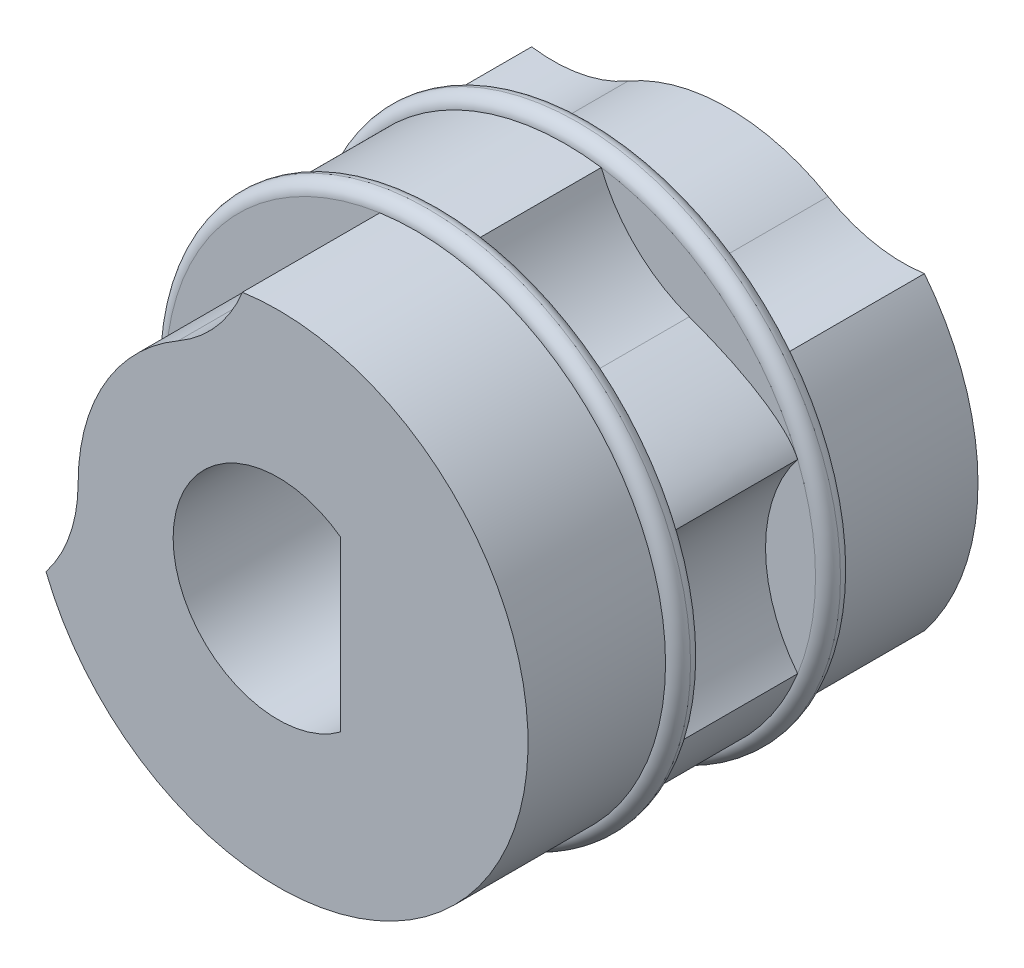
from build123d import *

# Parameters (mm, degrees)
BOSS_EXTRUDE3_DEPTH      = 6
BOSS_EXTRUDE6_DEPTH      = 0.5
BOSS_EXTRUDE6_DEPTH_BACK = 0.5
BOSS_EXTRUDE6_START      = 6
SKETCH3_R                = 10.5
SKETCH3_R_2              = 4.2
BOSS_EXTRUDE4_START      = 6
BOSS_EXTRUDE4_DEPTH      = 6
BOSS_EXTRUDE7_DEPTH      = 0.5
BOSS_EXTRUDE7_DEPTH_BACK = 0.5
BOSS_EXTRUDE7_START      = 12
SKETCH3_2_R              = 10.5
SKETCH3_2_R_2            = 4.2
BOSS_EXTRUDE5_START      = 12
BOSS_EXTRUDE5_DEPTH      = 6
FILLET1_R                = 0.5
FILLET2_START            = -1
FILLET2_DEPTH            = 6.5
FILLET2_START_2          = 6.5
FILLET2_2_DEPTH          = 5


with BuildPart() as part:
    # Sketch1 → Boss-Extrude3 (new body)
    with BuildSketch(Plane.XY):
        with BuildLine():
            ThreePointArc((7.857142857, -6.185895741), (10, 0), (7.857142857, 6.185895741))
            ThreePointArc((7.857142857, 6.185895741), (5.866106634, 6.232472606), (4.000000094, 6.928203176))
            ThreePointArc((4.000000094, 6.928203176), (-5.7e-08, 8), (-4.000000192, 6.92820312))
            ThreePointArc((-4.000000192, 6.92820312), (-5.86610669, 6.232472596), (-7.857142857, 6.185895741))
            ThreePointArc((-7.857142857, 6.185895741), (-10, 0), (-7.857142857, -6.185895741))
            ThreePointArc((-7.857142857, -6.185895741), (-4, -6.92820323), (-1.428571429, -9.897433186))
            ThreePointArc((-1.428571429, -9.897433186), (0, -10), (1.428571429, -9.897433186))
            ThreePointArc((1.428571429, -9.897433186), (4, -6.92820323), (7.857142857, -6.185895741))
        make_face()
        with BuildLine():
            Line((2.5, 3.374907406), (2.5, -3.374907406))
            ThreePointArc((2.5, -3.374907406), (-4.2, 0), (2.5, 3.374907406))
        make_face(mode=Mode.SUBTRACT)
    extrude(amount=BOSS_EXTRUDE3_DEPTH)

    # Sketch1<3> → Boss-Extrude4 (add)
    with BuildSketch(Plane.XY.offset(BOSS_EXTRUDE4_START)):
        with BuildLine():
            ThreePointArc((9.285714286, -3.711537445), (8, 0), (9.285714286, 3.711537445))
            ThreePointArc((9.285714286, 3.711537445), (8.660254038, 5), (7.857142857, 6.185895741))
            ThreePointArc((7.857142857, 6.185895741), (4, 6.92820323), (1.428571429, 9.897433186))
            ThreePointArc((1.428571429, 9.897433186), (-5, 8.660254038), (-9.285714286, 3.711537445))
            ThreePointArc((-9.285714286, 3.711537445), (-8.330532909, 1.963961024), (-8, 2.5e-08))
            ThreePointArc((-8, 2.5e-08), (-6.928203234, -3.999999994), (-3.99999999, -6.928203236))
            ThreePointArc((-3.99999999, -6.928203236), (-2.46442632, -8.196433633), (-1.428571429, -9.897433186))
            ThreePointArc((-1.428571429, -9.897433186), (5, -8.660254038), (9.285714286, -3.711537445))
        make_face()
        with BuildLine():
            Line((2.5, 3.374907406), (2.5, -3.374907406))
            ThreePointArc((2.5, -3.374907406), (-4.2, 0), (2.5, 3.374907406))
        make_face(mode=Mode.SUBTRACT)
    extrude(amount=BOSS_EXTRUDE4_DEPTH)

    # Sketch1<4> → Boss-Extrude5 (add)
    with BuildSketch(Plane.XY.offset(BOSS_EXTRUDE5_START)):
        with BuildLine():
            ThreePointArc((-4.000000192, 6.92820312), (-6.928203279, 3.999999915), (-8, 2.5e-08))
            ThreePointArc((-8, 2.5e-08), (-8.330532901, -1.963961), (-9.285714286, -3.711537445))
            ThreePointArc((-9.285714286, -3.711537445), (8.660254038, -5), (-1.428571429, 9.897433186))
            ThreePointArc((-1.428571429, 9.897433186), (-2.464426396, 8.196433545), (-4.000000192, 6.92820312))
        make_face()
        with BuildLine():
            Line((2.5, 3.374907406), (2.5, -3.374907406))
            ThreePointArc((2.5, -3.374907406), (-4.2, 0), (2.5, 3.374907406))
        make_face(mode=Mode.SUBTRACT)
    extrude(amount=BOSS_EXTRUDE5_DEPTH)


with BuildPart() as body_2:
    # Sketch3 → Boss-Extrude6 (new, two sides: drawn at the far end of the back side and taken through both)
    with BuildSketch(Plane.XY.offset(BOSS_EXTRUDE6_START - BOSS_EXTRUDE6_DEPTH_BACK)):
        Circle(SKETCH3_R)
        Circle(SKETCH3_R_2, mode=Mode.SUBTRACT)
    extrude(amount=BOSS_EXTRUDE6_DEPTH + BOSS_EXTRUDE6_DEPTH_BACK)


with BuildPart() as body_3:
    # Sketch3<2> → Boss-Extrude7 (new, two sides: drawn at the far end of the back side and taken through both)
    with BuildSketch(Plane.XY.offset(BOSS_EXTRUDE7_START - BOSS_EXTRUDE7_DEPTH_BACK)):
        Circle(SKETCH3_2_R)
        Circle(SKETCH3_2_R_2, mode=Mode.SUBTRACT)
    extrude(amount=BOSS_EXTRUDE7_DEPTH + BOSS_EXTRUDE7_DEPTH_BACK)


with BuildPart() as part_1:
    add(part.part)

    # Combine1: union body 3, body 2
    add(body_3.part)
    add(body_2.part)

    # Fillet1
    fillet1_edges = [part_1.edges().sort_by_distance(p)[0] for p in [
        (-10.5, 0, 11.5),
        (-10.5, 0, 12.5),
        (-10.5, 0, 5.5),
        (-10.5, 0, 6.5),
    ]]
    fillet(fillet1_edges, radius=FILLET1_R - 0.0001)  # a hair under: the kernel refuses the full size

    # Fillet2: read off the stored shape, not the designer's step
    # Fillet2 outline → Fillet2 (cut)
    with BuildSketch(Plane.XY.offset(FILLET2_START)):
        with BuildLine():
            add(Edge.make_bspline(
                [(-3.14208784, -7.529084848), (-0.130949677, -10.057054805), (1.428571429, -9.897433186)],
                knots=[0, 0, 0, 1, 1, 1], degree=2, weights=[1, 0.920985497, 1]))
            ThreePointArc((-3.14208784, -7.529084848), (-2.138890547, -8.607309324), (-1.428571429, -9.897433186))
            ThreePointArc((-1.428571429, -9.897433186), (0, -10), (1.428571429, -9.897433186))
        make_face()
    extrude(amount=FILLET2_DEPTH, mode=Mode.SUBTRACT)

    # Fillet2 2 outline → Fillet2 2 (cut)
    with BuildSketch(Plane.XY.offset(FILLET2_START_2)):
        with BuildLine():
            add(Edge.make_bspline(
                [(9.285714286, 3.711537445), (8.64419011, 5.141933149), (4.949334826, 6.485670315)],
                knots=[0, 0, 0, 1, 1, 1], degree=2, weights=[1, 0.920985497, 1]))
            ThreePointArc((9.285714286, 3.711537445), (8.660254038, 5), (7.857142857, 6.185895741))
            ThreePointArc((7.857142857, 6.185895741), (6.384703259, 6.155988211), (4.949334826, 6.485670315))
        make_face()
    extrude(amount=FILLET2_2_DEPTH, mode=Mode.SUBTRACT)


solid = part_1.part
